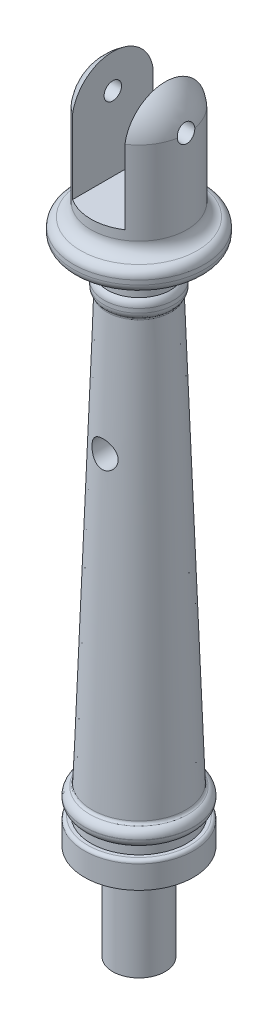
from build123d import *

# Parameters (mm, degrees)
SKETCH3_R           = 12.5
BOSS_EXTRUDE1_DEPTH = 6
BOSS_EXTRUDE4_START = -12
SKETCH6_R           = 12.5
BOSS_EXTRUDE4_DEPTH = 4
FILLET1_R           = 2
FILLET2_R           = 0.75
SKETCH7_R           = 6
BOSS_EXTRUDE5_DEPTH = 22
CUT_EXTRUDE2_START  = -15
CUT_EXTRUDE2_DEPTH  = 15
BOSS_EXTRUDE6_START = -8
SKETCH9_R           = 8
BOSS_EXTRUDE6_DEPTH = 2
FILLET3_R           = 2
FILLET4_R           = 0.75
SKETCH10_R          = 15
BOSS_EXTRUDE7_DEPTH = 5
SKETCH11_R          = 11
BOSS_EXTRUDE8_DEPTH = 22
FILLET5_R           = 2
FILLET6_R           = 3
FILLET7_R           = 2
SKETCH14_W          = 12
SKETCH14_H          = 27.418051074
CUT_EXTRUDE3_DEPTH  = 11
SKETCH15_R          = 3
CUT_EXTRUDE4_DEPTH  = 11
SKETCH16_R          = 2
CUT_EXTRUDE5_DEPTH  = 11


with BuildPart() as part:
    # Sketch2 → Revolve2 (revolve)
    with BuildSketch(Plane.XY, mode=Mode.PRIVATE) as revolve2_sk:
        Polygon((0, 0), (11, 0), (7, 114), (0, 114), align=None)
    revolve(revolve2_sk.sketch.rotate(Axis((0, 114, 0), (0, -1, 0)), 90), axis=Axis((0, 114, 0), (0, -1, 0)))

    # Sketch3 → Boss-Extrude1 (add)
    with BuildSketch(Plane.XZ):
        with Locations(Location((0, 0, 0), (0, 0, 270))):
            Circle(SKETCH3_R)
    extrude(amount=BOSS_EXTRUDE1_DEPTH)

    # Sketch6 → Boss-Extrude4 (add)
    with BuildSketch(Plane.XZ.offset(6).offset(BOSS_EXTRUDE4_START)):
        with Locations(Location((0, 0, 0), (0, 0, 270))):
            Circle(SKETCH6_R)
    extrude(amount=BOSS_EXTRUDE4_DEPTH)

    # Fillet1
    # the kernel refuses this fillet: 2 mm, written as the material it takes off along each edge
    with BuildSketch(Plane(origin=(0, 6, 0), x_dir=(0, 0, -1), z_dir=(-1, 0, 0))) as fillet1_piece_1:
        with BuildLine():
            CenterArc((10.5, 1.97894037), FILLET1_R, 278.322040599, 81.677959401)
            Line((10.789473684, 0), (10.795263158, -0.039578807))
            ThreePointArc((10.795263158, -0.039578807), (11.644736842, -0.04), (12.5, -0.04))
            Line((12.5, -0.04), (12.54, 0))
            Line((12.54, 0), (12.54, 1.97894037))
            Line((12.54, 1.97894037), (12.5, 1.97894037))
        make_face()
    revolve(axis=Axis((0, 6, 0), (0, -1, 0)), mode=Mode.SUBTRACT)
    with BuildSketch(Plane(origin=(0, 2, 0), x_dir=(0, 0, -1), z_dir=(-1, 0, 0))) as fillet1_piece_2:
        with BuildLine():
            CenterArc((10.5, -1.953266712), FILLET1_R, 0, 77.589618941)
            Line((12.5, -1.953266712), (12.54, -1.953266712))
            Line((12.54, -1.953266712), (12.54, 0))
            Line((12.54, 0), (12.5, 0.04))
            ThreePointArc((12.5, 0.04), (11.714912281, 0.04), (10.938421053, 0.039065334))
            Line((10.938421053, 0.039065334), (10.929824561, 0))
        make_face()
    revolve(axis=Axis((0, 2, 0), (0, -1, 0)), mode=Mode.SUBTRACT)

    # Fillet2
    fillet2_edges = [part.edges().sort_by_distance(p)[0] for p in [
        (0, 0, 12.5),
        (10.789473684, 6, 0),
    ]]
    fillet(fillet2_edges, radius=FILLET2_R)

    # Sketch7 → Boss-Extrude5 (add)
    with BuildSketch(Plane.XZ.offset(6)):
        with Locations(Location((0, 0, 0), (0, 0, 270))):
            Circle(SKETCH7_R)
    extrude(amount=BOSS_EXTRUDE5_DEPTH)

    # Sketch8 → Cut-Extrude2 (cut)
    with BuildSketch(Plane.XZ.offset(28).offset(CUT_EXTRUDE2_START)):
        with BuildLine():
            Line((-5.141740966, 3.092329192), (-4.848481392, -3.534434635))
            ThreePointArc((-4.848481392, -3.534434635), (-5.994133415, -0.265263266), (-5.141740966, 3.092329192))
        make_face()
    extrude(amount=CUT_EXTRUDE2_DEPTH, mode=Mode.SUBTRACT)

    # Sketch9 → Boss-Extrude6 (add, symmetric)
    with BuildSketch(Plane(origin=(0, 114, 0), x_dir=(1, 0, 0), z_dir=(0, 1, 0)).offset(BOSS_EXTRUDE6_START)):
        with Locations(Location((0, 0, 0), (0, 0, 270))):
            Circle(SKETCH9_R)
    extrude(amount=BOSS_EXTRUDE6_DEPTH, both=True)

    # Fillet3
    # the kernel refuses this fillet: 2 mm, written as the material it takes off along each edge
    with BuildSketch(Plane(origin=(0, 104, 0), x_dir=(0, 0, 1), z_dir=(-1, 0, 0))) as fillet3_piece_1:
        with BuildLine():
            CenterArc((6, 1.474832468), FILLET3_R, 312.488219007, 47.511780993)
            Line((8, 1.474832468), (8.04, 1.474832468))
            Line((8.04, 1.474832468), (8.04, 0))
            Line((8.04, 0), (8, -0.04))
            ThreePointArc((8, -0.04), (7.675438596, -0.04), (7.377894737, -0.029496649))
            Line((7.377894737, -0.029496649), (7.350877193, 0))
        make_face()
    revolve(axis=Axis((0, 104, 0), (0, 1, 0)), mode=Mode.SUBTRACT)
    with BuildSketch(Plane(origin=(0, 108, 0), x_dir=(0, 0, 1), z_dir=(-1, 0, 0))) as fillet3_piece_2:
        with BuildLine():
            CenterArc((6, -1.592050891), FILLET3_R, 0, 52.752219104)
            Line((7.210526316, 0), (7.234736842, 0.031841018))
            ThreePointArc((7.234736842, 0.031841018), (7.605263158, 0.04), (8, 0.04))
            Line((8, 0.04), (8.04, 0))
            Line((8.04, 0), (8.04, -1.592050891))
            Line((8.04, -1.592050891), (8, -1.592050891))
        make_face()
    revolve(axis=Axis((0, 108, 0), (0, 1, 0)), mode=Mode.SUBTRACT)

    # Fillet4
    fillet4_edges = [part.edges().sort_by_distance(p)[0] for p in [
        (0, 104, -7.350877193),
    ]]
    fillet(fillet4_edges, radius=FILLET4_R)

    # Sketch10 → Boss-Extrude7 (add)
    with BuildSketch(Plane(origin=(0, 114, 0), x_dir=(1, 0, 0), z_dir=(0, 1, 0))):
        with Locations(Location((0, 0, 0), (0, 0, 270))):
            Circle(SKETCH10_R)
    extrude(amount=BOSS_EXTRUDE7_DEPTH)

    # Sketch11 → Boss-Extrude8 (add)
    with BuildSketch(Plane(origin=(0, 119, 0), x_dir=(1, 0, 0), z_dir=(0, 1, 0))):
        with Locations(Location((0, 0, 0), (0, 0, 270))):
            Circle(SKETCH11_R)
    extrude(amount=BOSS_EXTRUDE8_DEPTH)

    # Fillet5
    fillet5_edges = [part.edges().sort_by_distance(p)[0] for p in [
        (0, 114, -15),
        (0, 119, -15),
    ]]
    fillet(fillet5_edges, radius=FILLET5_R)

    # Fillet6
    fillet6_edges = [part.edges().sort_by_distance(p)[0] for p in [
        (0, 119, -11),
    ]]
    fillet(fillet6_edges, radius=FILLET6_R)

    # Fillet7
    fillet7_edges = [part.edges().sort_by_distance(p)[0] for p in [
        (0, 114, -7),
    ]]
    fillet(fillet7_edges, radius=FILLET7_R)

    # Sketch13 → Revolve4 (revolve)
    with BuildSketch(Plane.XY, mode=Mode.PRIVATE) as revolve4_sk:
        with BuildLine():
            Line((11, 141), (0, 141))
            Line((0, 141), (0, 150.5))
            ThreePointArc((0, 150.5), (7.292505249, 147.825532394), (11, 141))
        make_face()
    revolve(revolve4_sk.sketch.rotate(Axis((0, 141, 0), (0, 1, 0)), 270), axis=Axis((0, 141, 0), (0, 1, 0)))

    # Sketch14 → Cut-Extrude3 (cut, symmetric)
    with BuildSketch(Plane.XY):
        with Locations((0, 137.709025537)):
            Rectangle(SKETCH14_W, SKETCH14_H)
    extrude(amount=CUT_EXTRUDE3_DEPTH, both=True, mode=Mode.SUBTRACT)

    # Sketch15 → Cut-Extrude4 (cut, symmetric)
    with BuildSketch(Plane.XY):
        with Locations(Location((0, 76, 0), (0, 0, 270.000000086))):
            Circle(SKETCH15_R)
    extrude(amount=CUT_EXTRUDE4_DEPTH, both=True, mode=Mode.SUBTRACT)

    # Sketch16 → Cut-Extrude5 (cut, symmetric)
    with BuildSketch(Plane(origin=(0, 0, 0), x_dir=(0, 0, -1), z_dir=(1, 0, 0))):
        with Locations((0, 141)):
            Circle(SKETCH16_R)
    extrude(amount=CUT_EXTRUDE5_DEPTH, both=True, mode=Mode.SUBTRACT)


solid = part.part
